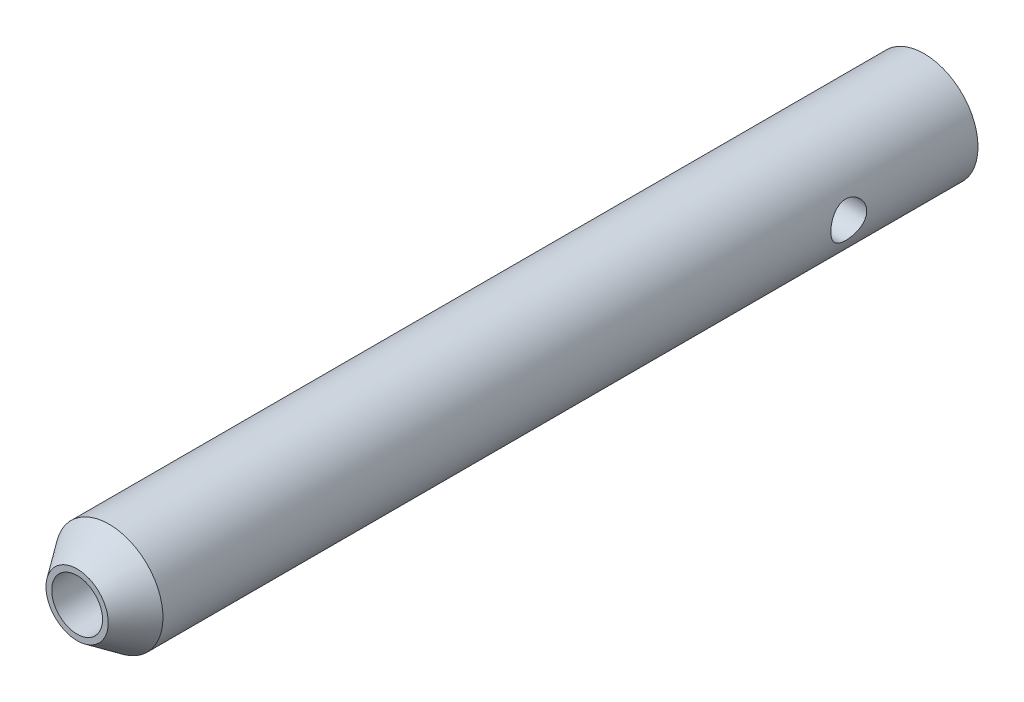
from build123d import *

# Parameters (mm, degrees)
CROQUIS2_W                        = 2.5
CROQUIS2_H                        = 108
CROQUIS3_W                        = 7.5
CROQUIS3_H                        = 2.5
DI_METRO_DE_TALADRO_5_0_5_1_D     = 5
DI_METRO_DE_TALADRO_5_0_5_1_DEPTH = 15
CHAFL_N1_SIZE                     = 0.747946905
CHAFL_N1_SIZE2                    = 1.053583954
CROQUIS5_R                        = 3.54
CORTAR_EXTRUIR1_DEPTH             = 61.731439717


# Read off the part's stored shape, not the designer's step: Sólido importado2
with BuildPart() as part:
    # Croquis1 → Revolución1 (revolve)
    with BuildSketch(Plane.XZ):
        Polygon((4.334336082, 118), (0, 118), (0, 0), (7.5, 0), (7.5, 113.540736), align=None)
    revolve(axis=Axis((0, 0, 118), (0, 0, -1)))

    # Croquis2 → Cortar-Revolución1 (revolve, cut)
    with BuildSketch(Plane.XZ, mode=Mode.PRIVATE) as cortar_revoluci_n1_sk:
        with Locations((1.25, 59)):
            Rectangle(CROQUIS2_W, CROQUIS2_H)
    revolve(cortar_revoluci_n1_sk.sketch.rotate(Axis((0, 0, 113), (0, 0, -1)), 180), axis=Axis((0, 0, 113), (0, 0, -1)), mode=Mode.SUBTRACT)

    # Croquis3 → Cortar-Revolución2 (revolve, cut)
    with BuildSketch(Plane.XY.offset(18), mode=Mode.PRIVATE) as cortar_revoluci_n2_sk:
        with Locations((3.75, -1.25)):
            Rectangle(CROQUIS3_W, CROQUIS3_H)
    revolve(cortar_revoluci_n2_sk.sketch.rotate(Axis((7.5, 0, 18), (-1, 0, 0)), 90), axis=Axis((7.5, 0, 18), (-1, 0, 0)), mode=Mode.SUBTRACT)

    # Diámetro de taladro Ø5.0 (5)1
    with Locations(Plane(origin=(-7.5, 0, 18), x_dir=(0, 0, -1), z_dir=(-1, 0, 0))):
        with Locations((0, 0)):
            Hole(DI_METRO_DE_TALADRO_5_0_5_1_D / 2, depth=DI_METRO_DE_TALADRO_5_0_5_1_DEPTH)

    # Chaflán1
    chafl_n1_edges = [part.edges().sort_by_distance(p)[0] for p in [
        (2.5, 0, 113),
    ]]
    chafl_n1_side = [part.faces().sort_by_distance(p)[0] for p in [
        (0, 0, 113),
    ]]
    chamfer(chafl_n1_edges, length=CHAFL_N1_SIZE, length2=CHAFL_N1_SIZE2, reference=chafl_n1_side[0])

    # Croquis5 → Cortar-Extruir1 (cut)
    with BuildSketch(Plane.XY.offset(118)):
        Circle(CROQUIS5_R)
    extrude(amount=-CORTAR_EXTRUIR1_DEPTH, mode=Mode.SUBTRACT)


solid = part.part
